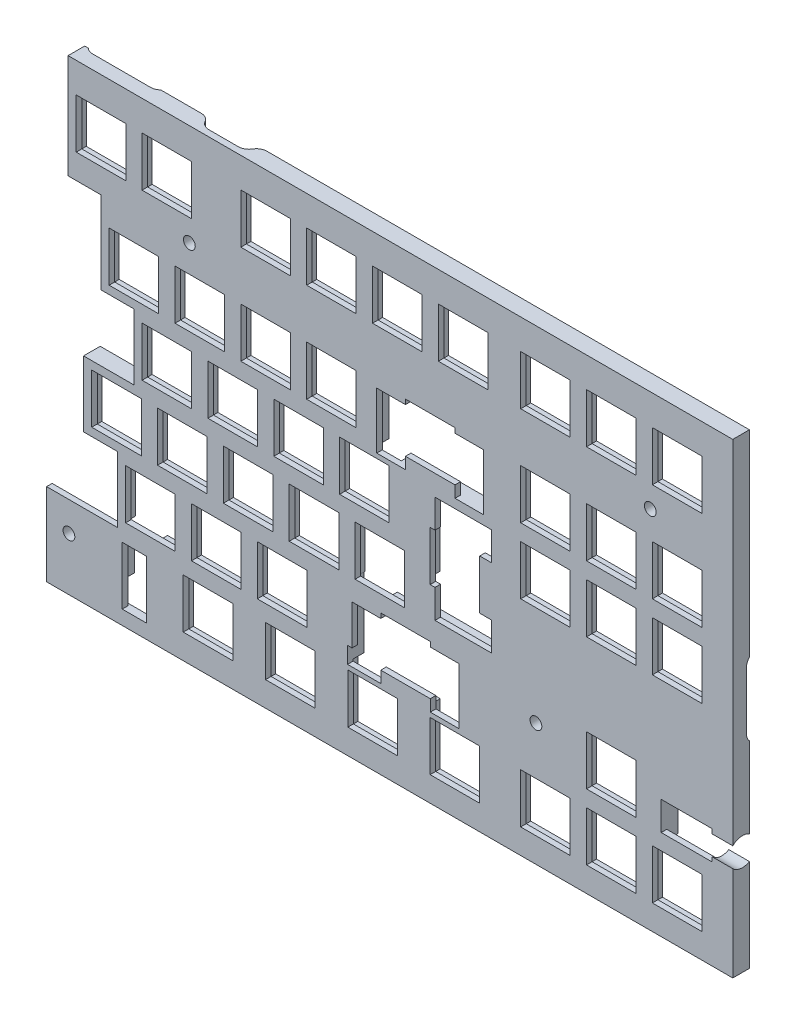
from build123d import *

# Parameters (mm, degrees)
BOSS_EXTRUDE1_OUTLINE_R   = 1.7
BOSS_EXTRUDE1_OUTLINE_W   = 18.1
BOSS_EXTRUDE1_OUTLINE_H   = 18.1
BOSS_EXTRUDE1_DEPTH       = 3.2
BOSS_EXTRUDE2_START       = 3.2
BOSS_EXTRUDE2_OUTLINE_R   = 1.7
BOSS_EXTRUDE2_OUTLINE_W   = 7
BOSS_EXTRUDE2_OUTLINE_H   = 13
BOSS_EXTRUDE2_OUTLINE_W_2 = 14.3
BOSS_EXTRUDE2_OUTLINE_H_2 = 14.3
BOSS_EXTRUDE2_DEPTH       = 1.6
BOSS_EXTRUDE3_DEPTH       = 3.1
BOSS_EXTRUDE4_DEPTH       = 1
BOSS_EXTRUDE5_DEPTH       = 3.1
BOSS_EXTRUDE6_START       = 1
BOSS_EXTRUDE6_DEPTH       = 1
SKETCH7_R                 = 4
CUT_EXTRUDE2_DEPTH        = 4.05
SKETCH8_W                 = 14.7
SKETCH8_H                 = 8.3
CUT_EXTRUDE3_DEPTH        = 4.8
BOSS_EXTRUDE7_START       = 3.1
BOSS_EXTRUDE7_DEPTH       = 3.1
BOSS_EXTRUDE8_DEPTH       = 1
CUT_EXTRUDE4_START        = 4.1
SKETCH7_2_R               = 4
CUT_EXTRUDE4_DEPTH        = 4.1
SKETCH11_R                = 4
CUT_EXTRUDE5_DEPTH        = 2
SKETCH12_W                = 6.886
SKETCH12_H                = 3.4
CUT_EXTRUDE6_DEPTH        = 3
CUT_EXTRUDE7_START        = -4.1
SKETCH13_W                = 12.930296958
SKETCH13_H                = 3
CUT_EXTRUDE7_DEPTH        = 4.1
FILLET1_R                 = 3
FILLET2_R                 = 3
SKETCH14_W                = 14.7
SKETCH14_H                = 13.65
CUT_EXTRUDE8_DEPTH        = 3.2
SKETCH15_W                = 8.288
SKETCH15_H                = 4.75
SKETCH15_W_2              = 4.75
SKETCH15_H_2              = 8.25
SKETCH15_W_3              = 9.576
SKETCH15_W_4              = 7
SKETCH15_H_3              = 3.7
CUT_EXTRUDE12_DEPTH       = 1.6
CUT_EXTRUDE13_START       = -3.2
SKETCH16_W                = 20.537
SKETCH16_H                = 5.5
CUT_EXTRUDE13_DEPTH       = 3.2


with BuildPart() as part:
    # Boss-Extrude1: read off the stored shape, not the designer's step
    # Boss-Extrude1 outline → Boss-Extrude1 (new body)
    with BuildSketch(Plane.XY):
        Polygon((-17.7, -43.5), (-17.7, -57.2), (2.837, -57.2), (2.837, -42.8), (3.2, -42.8), (3.2, -24.95), (21.3, -24.95), (21.3, -43.05), (12.413, -43.05), (12.413, -63.2), (176.2, -63.2), (176.2, 63.2), (-11.5, 63.2), (-11.5, 37.25), (-2, 37.25), (-2, 13.5), (7.5, 13.5), (7.5, -5.5), (-7.03, -5.5), (-7.03, -24.5), (2.75, -24.5), (2.75, -43.5), align=None)
        with Locations((-11.25, -52)):
            Circle(BOSS_EXTRUDE1_OUTLINE_R, mode=Mode.SUBTRACT)
        with Locations((28.875, -53)):
            Rectangle(BOSS_EXTRUDE1_OUTLINE_W, BOSS_EXTRUDE1_OUTLINE_H, mode=Mode.SUBTRACT)
        with Locations((52.625, -53)):
            Rectangle(BOSS_EXTRUDE1_OUTLINE_W, BOSS_EXTRUDE1_OUTLINE_H, mode=Mode.SUBTRACT)
        with Locations((31.25, -34)):
            Rectangle(BOSS_EXTRUDE1_OUTLINE_W, BOSS_EXTRUDE1_OUTLINE_H, mode=Mode.SUBTRACT)
        with Locations((50.25, -34)):
            Rectangle(BOSS_EXTRUDE1_OUTLINE_W, BOSS_EXTRUDE1_OUTLINE_H, mode=Mode.SUBTRACT)
        with Locations((2.47, -15)):
            Rectangle(BOSS_EXTRUDE1_OUTLINE_W, BOSS_EXTRUDE1_OUTLINE_H, mode=Mode.SUBTRACT)
        with Locations((21.47, -15)):
            Rectangle(BOSS_EXTRUDE1_OUTLINE_W, BOSS_EXTRUDE1_OUTLINE_H, mode=Mode.SUBTRACT)
        with Locations((40.47, -15)):
            Rectangle(BOSS_EXTRUDE1_OUTLINE_W, BOSS_EXTRUDE1_OUTLINE_H, mode=Mode.SUBTRACT)
        with Locations((59.47, -15)):
            Rectangle(BOSS_EXTRUDE1_OUTLINE_W, BOSS_EXTRUDE1_OUTLINE_H, mode=Mode.SUBTRACT)
        with Locations((126.25, -53)):
            Rectangle(BOSS_EXTRUDE1_OUTLINE_W, BOSS_EXTRUDE1_OUTLINE_H, mode=Mode.SUBTRACT)
        Polygon((91.075, -62.05), (91.075, -44.5), (85.425, -44.5), (85.425, -62.05), (67.325, -62.05), (67.325, -43.95), (69.149, -43.95), (69.149, -23.5), (69.42, -23.5), (69.42, -5.95), (87.52, -5.95), (87.52, -24.05), (78.725, -24.05), (78.725, -24.95), (93.025, -24.95), (93.025, -23.5), (102.601, -23.5), (102.601, -43.95), (109.175, -43.95), (109.175, -62.05), align=None, mode=Mode.SUBTRACT)
        with Locations((123.5, -32)):
            Circle(BOSS_EXTRUDE1_OUTLINE_R, mode=Mode.SUBTRACT)
        with Locations((145.25, -53)):
            Rectangle(BOSS_EXTRUDE1_OUTLINE_W, BOSS_EXTRUDE1_OUTLINE_H, mode=Mode.SUBTRACT)
        with Locations((164.25, -53)):
            Rectangle(BOSS_EXTRUDE1_OUTLINE_W, BOSS_EXTRUDE1_OUTLINE_H, mode=Mode.SUBTRACT)
        with Locations((145.25, -34)):
            Rectangle(BOSS_EXTRUDE1_OUTLINE_W, BOSS_EXTRUDE1_OUTLINE_H, mode=Mode.SUBTRACT)
        Polygon((110.62, 11.15), (110.62, -22.15), (89.62, -22.15), (89.62, -12.65), (91.07, -12.65), (91.07, 1.65), (89.62, 1.65), (89.62, 11.15), align=None, mode=Mode.SUBTRACT)
        with Locations((17, 4)):
            Rectangle(BOSS_EXTRUDE1_OUTLINE_W, BOSS_EXTRUDE1_OUTLINE_H, mode=Mode.SUBTRACT)
        with Locations((7.5, 23)):
            Rectangle(BOSS_EXTRUDE1_OUTLINE_W, BOSS_EXTRUDE1_OUTLINE_H, mode=Mode.SUBTRACT)
        with Locations((26.5, 23)):
            Rectangle(BOSS_EXTRUDE1_OUTLINE_W, BOSS_EXTRUDE1_OUTLINE_H, mode=Mode.SUBTRACT)
        with Locations((36, 4)):
            Rectangle(BOSS_EXTRUDE1_OUTLINE_W, BOSS_EXTRUDE1_OUTLINE_H, mode=Mode.SUBTRACT)
        with Locations((55, 4)):
            Rectangle(BOSS_EXTRUDE1_OUTLINE_W, BOSS_EXTRUDE1_OUTLINE_H, mode=Mode.SUBTRACT)
        with Locations((45.5, 23)):
            Rectangle(BOSS_EXTRUDE1_OUTLINE_W, BOSS_EXTRUDE1_OUTLINE_H, mode=Mode.SUBTRACT)
        with Locations((64.5, 23)):
            Rectangle(BOSS_EXTRUDE1_OUTLINE_W, BOSS_EXTRUDE1_OUTLINE_H, mode=Mode.SUBTRACT)
        with Locations((23.5, 38)):
            Circle(BOSS_EXTRUDE1_OUTLINE_R, mode=Mode.SUBTRACT)
        with Locations((-2, 51.5)):
            Rectangle(BOSS_EXTRUDE1_OUTLINE_W, BOSS_EXTRUDE1_OUTLINE_H, mode=Mode.SUBTRACT)
        with Locations((17, 51.5)):
            Rectangle(BOSS_EXTRUDE1_OUTLINE_W, BOSS_EXTRUDE1_OUTLINE_H, mode=Mode.SUBTRACT)
        with Locations((45.5, 51.5)):
            Rectangle(BOSS_EXTRUDE1_OUTLINE_W, BOSS_EXTRUDE1_OUTLINE_H, mode=Mode.SUBTRACT)
        with Locations((64.5, 51.5)):
            Rectangle(BOSS_EXTRUDE1_OUTLINE_W, BOSS_EXTRUDE1_OUTLINE_H, mode=Mode.SUBTRACT)
        Polygon((109.726, 33.5), (109.726, 12.5), (83.05, 12.5), (83.05, -5.05), (64.95, -5.05), (64.95, 13.05), (76.274, 13.05), (76.274, 33.5), (85.85, 33.5), (85.85, 32.05), (100.15, 32.05), (100.15, 33.5), align=None, mode=Mode.SUBTRACT)
        with Locations((126.25, 4)):
            Rectangle(BOSS_EXTRUDE1_OUTLINE_W, BOSS_EXTRUDE1_OUTLINE_H, mode=Mode.SUBTRACT)
        with Locations((126.25, 23)):
            Rectangle(BOSS_EXTRUDE1_OUTLINE_W, BOSS_EXTRUDE1_OUTLINE_H, mode=Mode.SUBTRACT)
        with Locations((145.25, 4)):
            Rectangle(BOSS_EXTRUDE1_OUTLINE_W, BOSS_EXTRUDE1_OUTLINE_H, mode=Mode.SUBTRACT)
        with Locations((164.25, 4)):
            Rectangle(BOSS_EXTRUDE1_OUTLINE_W, BOSS_EXTRUDE1_OUTLINE_H, mode=Mode.SUBTRACT)
        with Locations((145.25, 23)):
            Rectangle(BOSS_EXTRUDE1_OUTLINE_W, BOSS_EXTRUDE1_OUTLINE_H, mode=Mode.SUBTRACT)
        with Locations((164.25, 23)):
            Rectangle(BOSS_EXTRUDE1_OUTLINE_W, BOSS_EXTRUDE1_OUTLINE_H, mode=Mode.SUBTRACT)
        with Locations((83.5, 51.5)):
            Rectangle(BOSS_EXTRUDE1_OUTLINE_W, BOSS_EXTRUDE1_OUTLINE_H, mode=Mode.SUBTRACT)
        with Locations((102.5, 51.5)):
            Rectangle(BOSS_EXTRUDE1_OUTLINE_W, BOSS_EXTRUDE1_OUTLINE_H, mode=Mode.SUBTRACT)
        with Locations((126.25, 51.5)):
            Rectangle(BOSS_EXTRUDE1_OUTLINE_W, BOSS_EXTRUDE1_OUTLINE_H, mode=Mode.SUBTRACT)
        with Locations((156.5, 38)):
            Circle(BOSS_EXTRUDE1_OUTLINE_R, mode=Mode.SUBTRACT)
        with Locations((145.25, 51.5)):
            Rectangle(BOSS_EXTRUDE1_OUTLINE_W, BOSS_EXTRUDE1_OUTLINE_H, mode=Mode.SUBTRACT)
        with Locations((164.25, 51.5)):
            Rectangle(BOSS_EXTRUDE1_OUTLINE_W, BOSS_EXTRUDE1_OUTLINE_H, mode=Mode.SUBTRACT)
    extrude(amount=BOSS_EXTRUDE1_DEPTH)

    # Boss-Extrude2: read off the stored shape, not the designer's step
    # Boss-Extrude2 outline → Boss-Extrude2 (add)
    with BuildSketch(Plane.XY.offset(BOSS_EXTRUDE2_START)):
        Polygon((-17.7, -43.5), (-17.7, -63.2), (176.2, -63.2), (176.2, 63.2), (-11.5, 63.2), (-11.5, 37.25), (-2, 37.25), (-2, 13.5), (7.5, 13.5), (7.5, -5.5), (-7.03, -5.5), (-7.03, -24.5), (2.75, -24.5), (2.75, -43.5), align=None)
        with Locations((-11.25, -52)):
            Circle(BOSS_EXTRUDE2_OUTLINE_R, mode=Mode.SUBTRACT)
        with Locations((7.625, -53)):
            Rectangle(BOSS_EXTRUDE2_OUTLINE_W, BOSS_EXTRUDE2_OUTLINE_H, mode=Mode.SUBTRACT)
        with Locations((28.875, -53)):
            Rectangle(BOSS_EXTRUDE2_OUTLINE_W_2, BOSS_EXTRUDE2_OUTLINE_H_2, mode=Mode.SUBTRACT)
        with Locations((12.25, -34)):
            Rectangle(BOSS_EXTRUDE2_OUTLINE_W_2, BOSS_EXTRUDE2_OUTLINE_H_2, mode=Mode.SUBTRACT)
        with Locations((52.625, -53)):
            Rectangle(BOSS_EXTRUDE2_OUTLINE_W_2, BOSS_EXTRUDE2_OUTLINE_H_2, mode=Mode.SUBTRACT)
        with Locations((76.375, -53)):
            Rectangle(BOSS_EXTRUDE2_OUTLINE_W_2, BOSS_EXTRUDE2_OUTLINE_H_2, mode=Mode.SUBTRACT)
        with Locations((31.25, -34)):
            Rectangle(BOSS_EXTRUDE2_OUTLINE_W_2, BOSS_EXTRUDE2_OUTLINE_H_2, mode=Mode.SUBTRACT)
        with Locations((50.25, -34)):
            Rectangle(BOSS_EXTRUDE2_OUTLINE_W_2, BOSS_EXTRUDE2_OUTLINE_H_2, mode=Mode.SUBTRACT)
        with Locations((2.47, -15)):
            Rectangle(BOSS_EXTRUDE2_OUTLINE_W_2, BOSS_EXTRUDE2_OUTLINE_H_2, mode=Mode.SUBTRACT)
        with Locations((21.47, -15)):
            Rectangle(BOSS_EXTRUDE2_OUTLINE_W_2, BOSS_EXTRUDE2_OUTLINE_H_2, mode=Mode.SUBTRACT)
        with Locations((40.47, -15)):
            Rectangle(BOSS_EXTRUDE2_OUTLINE_W_2, BOSS_EXTRUDE2_OUTLINE_H_2, mode=Mode.SUBTRACT)
        with Locations((59.47, -15)):
            Rectangle(BOSS_EXTRUDE2_OUTLINE_W_2, BOSS_EXTRUDE2_OUTLINE_H_2, mode=Mode.SUBTRACT)
        with Locations((78.47, -15)):
            Rectangle(BOSS_EXTRUDE2_OUTLINE_W_2, BOSS_EXTRUDE2_OUTLINE_H_2, mode=Mode.SUBTRACT)
        with Locations((100.125, -53)):
            Rectangle(BOSS_EXTRUDE2_OUTLINE_W_2, BOSS_EXTRUDE2_OUTLINE_H_2, mode=Mode.SUBTRACT)
        with Locations((126.25, -53)):
            Rectangle(BOSS_EXTRUDE2_OUTLINE_W_2, BOSS_EXTRUDE2_OUTLINE_H_2, mode=Mode.SUBTRACT)
        Polygon((93.025, -41.15), (78.725, -41.15), (78.725, -39.75), (70.437, -39.75), (70.437, -28.25), (78.725, -28.25), (78.725, -26.85), (93.025, -26.85), (93.025, -28.25), (101.313, -28.25), (101.313, -39.75), (93.025, -39.75), align=None, mode=Mode.SUBTRACT)
        with Locations((123.5, -32)):
            Circle(BOSS_EXTRUDE2_OUTLINE_R, mode=Mode.SUBTRACT)
        with Locations((145.25, -53)):
            Rectangle(BOSS_EXTRUDE2_OUTLINE_W_2, BOSS_EXTRUDE2_OUTLINE_H_2, mode=Mode.SUBTRACT)
        with Locations((164.25, -53)):
            Rectangle(BOSS_EXTRUDE2_OUTLINE_W_2, BOSS_EXTRUDE2_OUTLINE_H_2, mode=Mode.SUBTRACT)
        with Locations((145.25, -34)):
            Rectangle(BOSS_EXTRUDE2_OUTLINE_W_2, BOSS_EXTRUDE2_OUTLINE_H_2, mode=Mode.SUBTRACT)
        Polygon((92.97, -12.65), (92.97, 1.65), (94.37, 1.65), (94.37, 9.9), (105.87, 9.9), (105.87, 1.65), (107.27, 1.65), (107.27, -12.65), (105.87, -12.65), (105.87, -20.9), (94.37, -20.9), (94.37, -12.65), align=None, mode=Mode.SUBTRACT)
        with Locations((17, 4)):
            Rectangle(BOSS_EXTRUDE2_OUTLINE_W_2, BOSS_EXTRUDE2_OUTLINE_H_2, mode=Mode.SUBTRACT)
        with Locations((7.5, 23)):
            Rectangle(BOSS_EXTRUDE2_OUTLINE_W_2, BOSS_EXTRUDE2_OUTLINE_H_2, mode=Mode.SUBTRACT)
        with Locations((26.5, 23)):
            Rectangle(BOSS_EXTRUDE2_OUTLINE_W_2, BOSS_EXTRUDE2_OUTLINE_H_2, mode=Mode.SUBTRACT)
        with Locations((36, 4)):
            Rectangle(BOSS_EXTRUDE2_OUTLINE_W_2, BOSS_EXTRUDE2_OUTLINE_H_2, mode=Mode.SUBTRACT)
        with Locations((55, 4)):
            Rectangle(BOSS_EXTRUDE2_OUTLINE_W_2, BOSS_EXTRUDE2_OUTLINE_H_2, mode=Mode.SUBTRACT)
        with Locations((74, 4)):
            Rectangle(BOSS_EXTRUDE2_OUTLINE_W_2, BOSS_EXTRUDE2_OUTLINE_H_2, mode=Mode.SUBTRACT)
        with Locations((45.5, 23)):
            Rectangle(BOSS_EXTRUDE2_OUTLINE_W_2, BOSS_EXTRUDE2_OUTLINE_H_2, mode=Mode.SUBTRACT)
        with Locations((64.5, 23)):
            Rectangle(BOSS_EXTRUDE2_OUTLINE_W_2, BOSS_EXTRUDE2_OUTLINE_H_2, mode=Mode.SUBTRACT)
        with Locations((23.5, 38)):
            Circle(BOSS_EXTRUDE2_OUTLINE_R, mode=Mode.SUBTRACT)
        with Locations((-2, 51.5)):
            Rectangle(BOSS_EXTRUDE2_OUTLINE_W_2, BOSS_EXTRUDE2_OUTLINE_H_2, mode=Mode.SUBTRACT)
        with Locations((17, 51.5)):
            Rectangle(BOSS_EXTRUDE2_OUTLINE_W_2, BOSS_EXTRUDE2_OUTLINE_H_2, mode=Mode.SUBTRACT)
        with Locations((45.5, 51.5)):
            Rectangle(BOSS_EXTRUDE2_OUTLINE_W_2, BOSS_EXTRUDE2_OUTLINE_H_2, mode=Mode.SUBTRACT)
        with Locations((64.5, 51.5)):
            Rectangle(BOSS_EXTRUDE2_OUTLINE_W_2, BOSS_EXTRUDE2_OUTLINE_H_2, mode=Mode.SUBTRACT)
        with Locations((126.25, 4)):
            Rectangle(BOSS_EXTRUDE2_OUTLINE_W_2, BOSS_EXTRUDE2_OUTLINE_H_2, mode=Mode.SUBTRACT)
        Polygon((100.15, 15.85), (85.85, 15.85), (85.85, 17.25), (77.562, 17.25), (77.562, 28.75), (85.85, 28.75), (85.85, 30.15), (100.15, 30.15), (100.15, 28.75), (108.438, 28.75), (108.438, 17.25), (100.15, 17.25), align=None, mode=Mode.SUBTRACT)
        with Locations((126.25, 23)):
            Rectangle(BOSS_EXTRUDE2_OUTLINE_W_2, BOSS_EXTRUDE2_OUTLINE_H_2, mode=Mode.SUBTRACT)
        with Locations((145.25, 4)):
            Rectangle(BOSS_EXTRUDE2_OUTLINE_W_2, BOSS_EXTRUDE2_OUTLINE_H_2, mode=Mode.SUBTRACT)
        with Locations((164.25, 4)):
            Rectangle(BOSS_EXTRUDE2_OUTLINE_W_2, BOSS_EXTRUDE2_OUTLINE_H_2, mode=Mode.SUBTRACT)
        with Locations((145.25, 23)):
            Rectangle(BOSS_EXTRUDE2_OUTLINE_W_2, BOSS_EXTRUDE2_OUTLINE_H_2, mode=Mode.SUBTRACT)
        with Locations((164.25, 23)):
            Rectangle(BOSS_EXTRUDE2_OUTLINE_W_2, BOSS_EXTRUDE2_OUTLINE_H_2, mode=Mode.SUBTRACT)
        with Locations((83.5, 51.5)):
            Rectangle(BOSS_EXTRUDE2_OUTLINE_W_2, BOSS_EXTRUDE2_OUTLINE_H_2, mode=Mode.SUBTRACT)
        with Locations((102.5, 51.5)):
            Rectangle(BOSS_EXTRUDE2_OUTLINE_W_2, BOSS_EXTRUDE2_OUTLINE_H_2, mode=Mode.SUBTRACT)
        with Locations((126.25, 51.5)):
            Rectangle(BOSS_EXTRUDE2_OUTLINE_W_2, BOSS_EXTRUDE2_OUTLINE_H_2, mode=Mode.SUBTRACT)
        with Locations((156.5, 38)):
            Circle(BOSS_EXTRUDE2_OUTLINE_R, mode=Mode.SUBTRACT)
        with Locations((145.25, 51.5)):
            Rectangle(BOSS_EXTRUDE2_OUTLINE_W_2, BOSS_EXTRUDE2_OUTLINE_H_2, mode=Mode.SUBTRACT)
        with Locations((164.25, 51.5)):
            Rectangle(BOSS_EXTRUDE2_OUTLINE_W_2, BOSS_EXTRUDE2_OUTLINE_H_2, mode=Mode.SUBTRACT)
    extrude(amount=BOSS_EXTRUDE2_DEPTH)

    # Sketch2 → Boss-Extrude3 (add)
    with BuildSketch(Plane.XZ.offset(63.2)):
        Polygon((176.2, 4.8), (-17.7, 4.8), (-17.7, 0), (-12.5, 0), (-12.5, 2.4884), (12.5, 2.4884), (12.5, 0), (176.2, 0), align=None)
    extrude(amount=BOSS_EXTRUDE3_DEPTH)

    # Sketch3 → Boss-Extrude4 (add)
    with BuildSketch(Plane.XZ.offset(66.3)):
        with BuildLine():
            ThreePointArc((-10.418902038, 0), (-9.493032479, 0.620467628), (-8.4, 0.8384))
            Line((-8.4, 0.8384), (8.4, 0.8384))
            ThreePointArc((8.4, 0.8384), (9.493032479, 0.620467628), (10.418902038, 0))
            Line((10.418902038, 0), (176.2, 0))
            Line((176.2, 0), (176.2, 4.8))
            Line((176.2, 4.8), (-17.7, 4.8))
            Line((-17.7, 4.8), (-17.7, 0))
            Line((-17.7, 0), (-10.418902038, 0))
        make_face()
    extrude(amount=BOSS_EXTRUDE4_DEPTH)

    # Sketch5 → Boss-Extrude5 (add)
    with BuildSketch(Plane(origin=(0, 63.2, 0), x_dir=(1, 0, 0), z_dir=(0, 1, 0))):
        Polygon((-11.5, -4.8), (176.2, -4.8), (176.2, 0), (12.5, 0), (12.5, -2.4884), (-11.5, -2.4884), align=None)
    extrude(amount=BOSS_EXTRUDE5_DEPTH)

    # Sketch6 → Boss-Extrude6 (add)
    with BuildSketch(Plane(origin=(0, 66.3, 0), x_dir=(1, 0, 0), z_dir=(0, 1, 0)).offset(BOSS_EXTRUDE6_START)):
        Polygon((12.5, 0), (12.5, -2.4884), (-11.5, -2.4884), (-11.5, -4.8), (176.2, -4.8), (176.2, 0), align=None)
        with BuildLine():
            ThreePointArc((10.418902038, 0), (9.493032479, -0.620467628), (8.4, -0.8384))
            Line((8.4, -0.8384), (-8.4, -0.8384))
            ThreePointArc((-8.4, -0.8384), (-9.493032479, -0.620467628), (-10.418902038, 0))
            Line((-10.418902038, 0), (-11.5, 0))
            Line((-11.5, 0), (-11.5, -2.4884))
            Line((-11.5, -2.4884), (12.5, -2.4884))
            Line((12.5, -2.4884), (12.5, 0))
            Line((12.5, 0), (10.418902038, 0))
        make_face()
    extrude(amount=-BOSS_EXTRUDE6_DEPTH)

    # Sketch7 → Cut-Extrude2 (cut)
    with BuildSketch(Plane(origin=(176.2, 0, 0), x_dir=(0, 0, -1), z_dir=(1, 0, 0))):
        with Locations((-2, -37.125)):
            Circle(SKETCH7_R)
    extrude(amount=-CUT_EXTRUDE2_DEPTH, mode=Mode.SUBTRACT)

    # Sketch8 → Cut-Extrude3 (cut)
    with BuildSketch(Plane.XY.offset(4.8)):
        with Locations((167, -37.125)):
            Rectangle(SKETCH8_W, SKETCH8_H)
    extrude(amount=-CUT_EXTRUDE3_DEPTH, mode=Mode.SUBTRACT)

    # Sketch9 → Boss-Extrude7 (add)
    with BuildSketch(Plane(origin=(176.2, 0, 0), x_dir=(0, 0, -1), z_dir=(1, 0, 0)).offset(BOSS_EXTRUDE7_START)):
        with BuildLine():
            Line((-4.8, 67.3), (-4.8, -34.268428629))
            ThreePointArc((-4.8, -34.268428629), (-2.502268105, -33.156659446), (0, -33.660898385))
            Line((0, -33.660898385), (0, -12.5))
            Line((0, -12.5), (-2.4884, -12.5))
            Line((-2.4884, -12.5), (-2.4884, 12.5))
            Line((-2.4884, 12.5), (0, 12.5))
            Line((0, 12.5), (0, 67.3))
            Line((0, 67.3), (-4.8, 67.3))
        make_face()
        with BuildLine():
            Line((-4.8, -34.268428629), (-4.8, -67.3))
            Line((-4.8, -67.3), (0, -67.3))
            Line((0, -67.3), (0, -33.660898385))
            ThreePointArc((0, -33.660898385), (-2.502268105, -33.156659446), (-4.8, -34.268428629))
        make_face()
    extrude(amount=-BOSS_EXTRUDE7_DEPTH)

    # Sketch10 → Boss-Extrude8 (add)
    with BuildSketch(Plane(origin=(179.3, 0, 0), x_dir=(0, 0, -1), z_dir=(1, 0, 0))):
        Polygon((-2.4884, -12.5), (-2.4884, 12.5), (0, 12.5), (0, 67.3), (-4.8, 67.3), (-4.8, -67.3), (0, -67.3), (0, -12.5), align=None)
        with BuildLine():
            Line((-2.4884, -12.5), (0, -12.5))
            Line((0, -12.5), (0, -10.418902038))
            ThreePointArc((0, -10.418902038), (-0.620467628, -9.493032479), (-0.8384, -8.4))
            Line((-0.8384, -8.4), (-0.8384, 8.4))
            ThreePointArc((-0.8384, 8.4), (-0.620467628, 9.493032479), (0, 10.418902038))
            Line((0, 10.418902038), (0, 12.5))
            Line((0, 12.5), (-2.4884, 12.5))
            Line((-2.4884, 12.5), (-2.4884, -12.5))
        make_face()
    extrude(amount=BOSS_EXTRUDE8_DEPTH)

    # Sketch7<2> → Cut-Extrude4 (cut)
    with BuildSketch(Plane(origin=(176.2, 0, 0), x_dir=(0, 0, -1), z_dir=(1, 0, 0)).offset(CUT_EXTRUDE4_START)):
        with Locations((-2, -37.125)):
            Circle(SKETCH7_2_R)
    extrude(amount=-CUT_EXTRUDE4_DEPTH, mode=Mode.SUBTRACT)

    # Sketch11 → Cut-Extrude5 (cut)
    with BuildSketch(Plane(origin=(0, 0, 0), x_dir=(-1, 0, 0), z_dir=(0, 0, -1))):
        with Locations((11.25, -52)):
            Circle(SKETCH11_R)
        with Locations((-123.5, -32)):
            Circle(SKETCH11_R)
        with Locations((-23.5, 38)):
            Circle(SKETCH11_R)
        with Locations((-156.5, 38)):
            Circle(SKETCH11_R)
    extrude(amount=-CUT_EXTRUDE5_DEPTH, mode=Mode.SUBTRACT)

    # Sketch12 → Cut-Extrude6 (cut)
    with BuildSketch(Plane(origin=(0, 0, 0), x_dir=(-1, 0, 0), z_dir=(0, 0, -1))):
        with Locations((-31.5, 61.3)):
            Rectangle(SKETCH12_W, SKETCH12_H)
    extrude(amount=-CUT_EXTRUDE6_DEPTH, mode=Mode.SUBTRACT)

    # Sketch13 → Cut-Extrude7 (cut)
    with BuildSketch(Plane(origin=(0, 67.3, 0), x_dir=(1, 0, 0), z_dir=(0, 1, 0)).offset(CUT_EXTRUDE7_START)):
        with Locations((31.6, -1.5)):
            Rectangle(SKETCH13_W, SKETCH13_H)
    extrude(amount=CUT_EXTRUDE7_DEPTH, mode=Mode.SUBTRACT)

    # Fillet1
    fillet1_edges = [part.edges().sort_by_distance(p)[0] for p in [
        (25.134851521, 65.25, 0),
        (38.065148479, 65.25, 0),
    ]]
    fillet(fillet1_edges, radius=FILLET1_R - 0.0001)  # a hair under: the kernel refuses the full size

    # Fillet2
    fillet2_edges = [part.edges().sort_by_distance(p)[0] for p in [
        (25.134851521, 65.25, 3),
        (38.065148479, 65.25, 3),
    ]]
    fillet(fillet2_edges, radius=FILLET2_R)

    # Sketch14 → Cut-Extrude8 (cut)
    with BuildSketch(Plane(origin=(0, 0, 0), x_dir=(-1, 0, 0), z_dir=(0, 0, -1))):
        with Locations((-167, -37.125)):
            Rectangle(SKETCH14_W, SKETCH14_H)
    extrude(amount=-CUT_EXTRUDE8_DEPTH, mode=Mode.SUBTRACT)

    # Sketch15 → Cut-Extrude12 (cut)
    with BuildSketch(Plane(origin=(0, 0, 3.2), x_dir=(-1, 0, 0), z_dir=(0, 0, -1))):
        with Locations((-104.294, 14.875)):
            Rectangle(SKETCH15_W, SKETCH15_H)
        with Locations((-81.706, 14.875)):
            Rectangle(SKETCH15_W, SKETCH15_H)
        with Locations((-108.245, 5.775)):
            Rectangle(SKETCH15_W_2, SKETCH15_H_2)
        with Locations((-108.245, -16.775)):
            Rectangle(SKETCH15_W_2, SKETCH15_H_2)
        with Locations((-97.169, -42.125)):
            Rectangle(SKETCH15_W, SKETCH15_H)
        with Locations((-73.937, -42.125)):
            Rectangle(SKETCH15_W_3, SKETCH15_H)
        with Locations((-7.625, -61.35)):
            Rectangle(SKETCH15_W_4, SKETCH15_H_3)
    extrude(amount=-CUT_EXTRUDE12_DEPTH, mode=Mode.SUBTRACT)

    # Sketch16 → Cut-Extrude13 (cut)
    with BuildSketch(Plane(origin=(0, 0, 0), x_dir=(-1, 0, 0), z_dir=(0, 0, -1)).offset(CUT_EXTRUDE13_START)):
        with Locations((7.4315, -45.8)):
            Rectangle(SKETCH16_W, SKETCH16_H)
    extrude(amount=CUT_EXTRUDE13_DEPTH, mode=Mode.SUBTRACT)


solid = part.part
